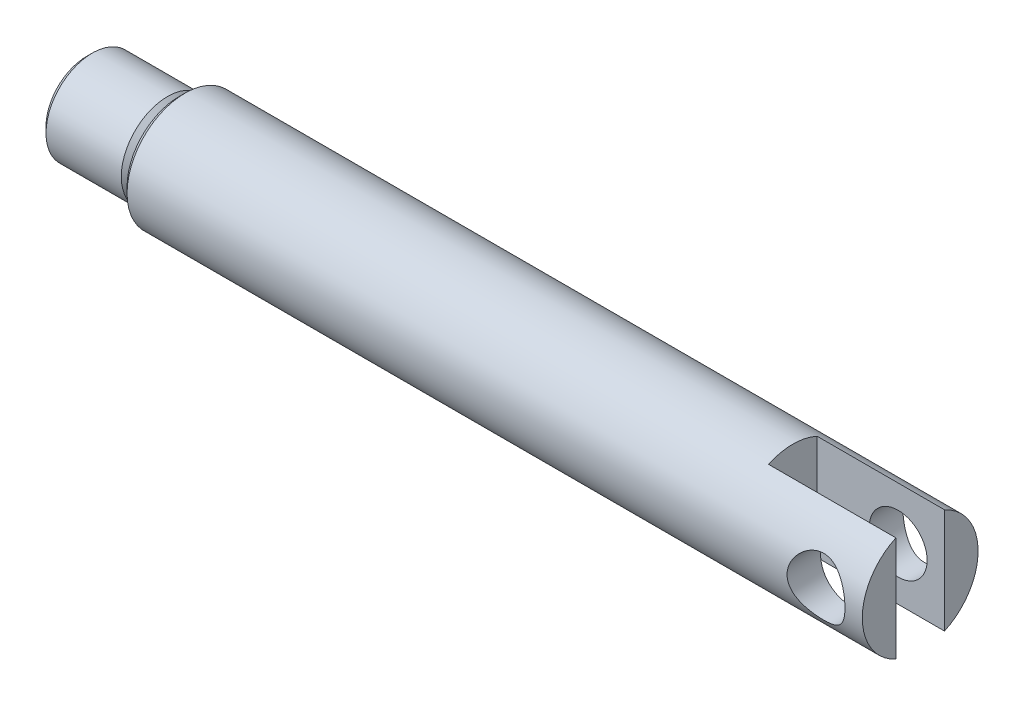
from build123d import *

# Parameters (mm, degrees)
SKETCH2_R          = 1.25
CUT_EXTRUDE1_DEPTH = 5
SKETCH3_W          = 2.1
SKETCH3_H          = 11.085015624
CUT_EXTRUDE2_DEPTH = 5.5
CHAMFER1_SIZE      = 0.25


with BuildPart() as part:
    # Sketch1 → Revolve1 (revolve)
    with BuildSketch(Plane.XY, mode=Mode.PRIVATE) as revolve1_sk:
        Polygon((0, 0), (36, 0), (36, -2.5), (4, -2.5), (4, -1.75), (3.5, -1.75), (3.5, -2), (0, -2), align=None)
    revolve(revolve1_sk.sketch.rotate(Axis((0, 0, 0), (1, 0, 0)), 270), axis=Axis((0, 0, 0), (1, 0, 0)))

    # Sketch2 → Cut-Extrude1 (cut, symmetric)
    with BuildSketch(Plane.XY):
        with Locations((34, 0)):
            Circle(SKETCH2_R)
    extrude(amount=CUT_EXTRUDE1_DEPTH, both=True, mode=Mode.SUBTRACT)

    # Sketch3 → Cut-Extrude2 (cut)
    with BuildSketch(Plane(origin=(36, 0, 0), x_dir=(0, 0, -1), z_dir=(1, 0, 0))):
        Rectangle(SKETCH3_W, SKETCH3_H)
    extrude(amount=-CUT_EXTRUDE2_DEPTH, mode=Mode.SUBTRACT)

    # Chamfer1
    chamfer1_edges = [part.edges().sort_by_distance(p)[0] for p in [
        (0, 0, -2),
        (4, 0, -2.5),
        (3.5, 0, -1.75),
    ]]
    chamfer(chamfer1_edges, length=CHAMFER1_SIZE - 0.0001)  # a hair under: the kernel refuses the full size


solid = part.part
